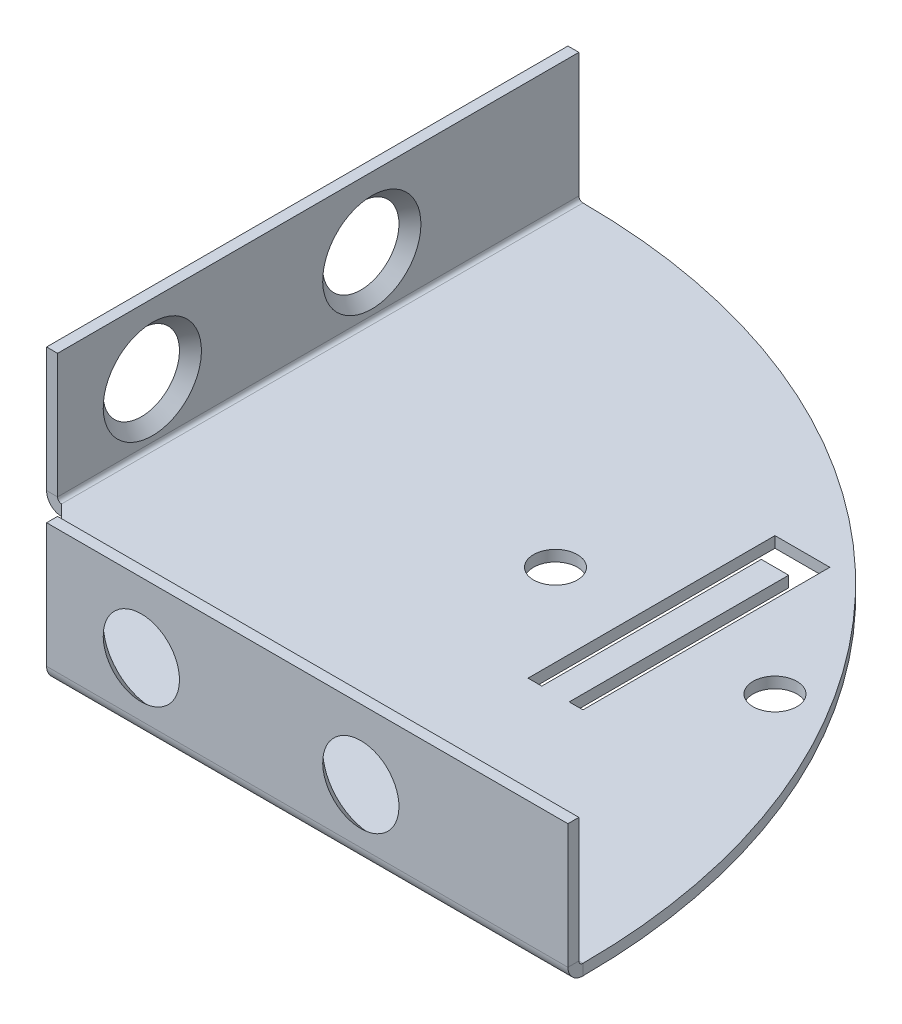
from build123d import *

# Parameters (mm, degrees)
BRIDA_BASE1_DEPTH               = 2
BRIDA_DE_ARISTA1_DEPTH          = 95
BRIDA_DE_ARISTA2_DEPTH          = 95
CROQUIS16_R                     = 4
CORTAR_EXTRUIR3_DEPTH           = 10
CROQUIS17_R                     = 8.95
CORTAR_EXTRUIR5_DEPTH           = 2
CORTAR_EXTRUIR5_DRAFT           = -45
CORTAR_EXTRUIR5_PROFILE_2_DEPTH = 2
CORTAR_EXTRUIR5_PROFILE_2_DRAFT = -45
CROQUIS18_R                     = 8.95
CORTAR_EXTRUIR6_DEPTH           = 2
CORTAR_EXTRUIR6_DRAFT           = -45
CORTAR_EXTRUIR6_PROFILE_2_DEPTH = 2
CORTAR_EXTRUIR6_PROFILE_2_DRAFT = -45


# Sheet-metal steps are written as plain solids
with BuildPart() as part:
    # Croquis1 → Brida base1 (new body)
    with BuildSketch(Plane(origin=(0, 0, 0), x_dir=(1, 0, 0), z_dir=(0, 1, 0))):
        with BuildLine():
            Line((0, 25), (25, 0))
            Line((25, 0), (120, 0))
            ThreePointArc((120, 0), (84.852813742, 84.852813742), (0, 120))
            Line((0, 120), (0, 25))
        make_face()
    extrude(amount=-BRIDA_BASE1_DEPTH)

    # Brida de arista1 section (across the edge) → Brida de arista1 (add)
    with BuildSketch(Plane(origin=(25, 0, 0.7366), x_dir=(0, 0, -1), z_dir=(1, 0, 0))):
        with BuildLine():
            Line((-2, 0.7366), (-2, 23.4))
            Line((-2, 23.4), (0, 23.4))
            Line((0, 23.4), (0, 0.7366))
            ThreePointArc((0, 0.7366), (0.215745145, 0.215745145), (0.7366, 0))
            Line((0.7366, 0), (0.7366, -2))
            ThreePointArc((0.7366, -2), (-1.198468417, -1.198468417), (-2, 0.7366))
        make_face()
    extrude(amount=BRIDA_DE_ARISTA1_DEPTH)

    # Brida de arista2 section (across the edge) → Brida de arista2 (add)
    with BuildSketch(Plane(origin=(-0.7366, 0, -120), x_dir=(1, 0, 0), z_dir=(0, 0, 1))):
        with BuildLine():
            Line((-2, 0.7366), (-2, 23.4))
            Line((-2, 23.4), (0, 23.4))
            Line((0, 23.4), (0, 0.7366))
            ThreePointArc((0, 0.7366), (0.215745145, 0.215745145), (0.7366, 0))
            Line((0.7366, 0), (0.7366, -2))
            ThreePointArc((0.7366, -2), (-1.198468417, -1.198468417), (-2, 0.7366))
        make_face()
    extrude(amount=BRIDA_DE_ARISTA2_DEPTH)

    # Croquis16 → Cortar-Extruir3 (cut)
    with BuildSketch(Plane(origin=(0, 0, 0), x_dir=(1, 0, 0), z_dir=(0, 1, 0))):
        with Locations(Location((55, 60, 0), (0, 0, 270))):
            Circle(CROQUIS16_R)
        with Locations(Location((95, 60, 0), (0, 0, 270))):
            Circle(CROQUIS16_R)
        Polygon((70, 40), (72.5, 40), (72.5, 80), (77.5, 80), (77.5, 40), (80, 40), (80, 85), (70, 85), align=None)
    extrude(amount=-CORTAR_EXTRUIR3_DEPTH, mode=Mode.SUBTRACT)


with BuildPart() as cortar_extruir5_tool:
    # Croquis17 → Cortar-Extruir5 (with draft: the straight prism first)
    with BuildSketch(Plane(origin=(0, 0, 0.7366), x_dir=(-1, 0, 0), z_dir=(0, 0, -1))):
        with Locations((-42.2634, 10.7)):
            Circle(CROQUIS17_R)
    extrude(amount=-CORTAR_EXTRUIR5_DEPTH)
    # Cortar-Extruir5: the draft: its side faces are tilted about the plane it starts from
    cortar_extruir5_sides = [cortar_extruir5_tool.faces().sort_by_distance(p)[0] for p in [
        (51.2134, 10.7, 1.7366),
    ]]
    draft(cortar_extruir5_sides, Plane(origin=(0, 0, 0.7366), x_dir=(-1, 0, 0), z_dir=(0, 0, -1)), CORTAR_EXTRUIR5_DRAFT)


with BuildPart() as part_1:
    add(part.part)

    # Cortar-Extruir5: cut by cortar_extruir5_tool
    add(cortar_extruir5_tool.part, mode=Mode.SUBTRACT)


with BuildPart() as cortar_extruir5_profile_2_tool:
    # Croquis17 → Cortar-Extruir5 profile 2 (with draft: the straight prism first)
    with BuildSketch(Plane(origin=(0, 0, 0.7366), x_dir=(-1, 0, 0), z_dir=(0, 0, -1))):
        with Locations((-82.2634, 10.7)):
            Circle(CROQUIS17_R)
    extrude(amount=-CORTAR_EXTRUIR5_PROFILE_2_DEPTH)
    # Cortar-Extruir5 profile 2: the draft: its side faces are tilted about the plane it starts from
    cortar_extruir5_profile_2_sides = [cortar_extruir5_profile_2_tool.faces().sort_by_distance(p)[0] for p in [
        (91.2134, 10.7, 1.7366),
    ]]
    draft(cortar_extruir5_profile_2_sides, Plane(origin=(0, 0, 0.7366), x_dir=(-1, 0, 0), z_dir=(0, 0, -1)), CORTAR_EXTRUIR5_PROFILE_2_DRAFT)


with BuildPart() as part_2:
    add(part_1.part)

    # Cortar-Extruir5 profile 2: cut by cortar_extruir5_profile_2_tool
    add(cortar_extruir5_profile_2_tool.part, mode=Mode.SUBTRACT)


with BuildPart() as cortar_extruir6_tool:
    # Croquis18 → Cortar-Extruir6 (with draft: the straight prism first)
    with BuildSketch(Plane(origin=(-0.7366, 0, 0), x_dir=(0, 0, -1), z_dir=(1, 0, 0))):
        with Locations((42.2634, 10.7)):
            Circle(CROQUIS18_R)
    extrude(amount=-CORTAR_EXTRUIR6_DEPTH)
    # Cortar-Extruir6: the draft: its side faces are tilted about the plane it starts from
    cortar_extruir6_sides = [cortar_extruir6_tool.faces().sort_by_distance(p)[0] for p in [
        (-1.7366, 10.7, -33.3134),
    ]]
    draft(cortar_extruir6_sides, Plane(origin=(-0.7366, 0, 0), x_dir=(0, 0, -1), z_dir=(1, 0, 0)), CORTAR_EXTRUIR6_DRAFT)


with BuildPart() as part_3:
    add(part_2.part)

    # Cortar-Extruir6: cut by cortar_extruir6_tool
    add(cortar_extruir6_tool.part, mode=Mode.SUBTRACT)


with BuildPart() as cortar_extruir6_profile_2_tool:
    # Croquis18 → Cortar-Extruir6 profile 2 (with draft: the straight prism first)
    with BuildSketch(Plane(origin=(-0.7366, 0, 0), x_dir=(0, 0, -1), z_dir=(1, 0, 0))):
        with Locations((82.2634, 10.7)):
            Circle(CROQUIS18_R)
    extrude(amount=-CORTAR_EXTRUIR6_PROFILE_2_DEPTH)
    # Cortar-Extruir6 profile 2: the draft: its side faces are tilted about the plane it starts from
    cortar_extruir6_profile_2_sides = [cortar_extruir6_profile_2_tool.faces().sort_by_distance(p)[0] for p in [
        (-1.7366, 10.7, -73.3134),
    ]]
    draft(cortar_extruir6_profile_2_sides, Plane(origin=(-0.7366, 0, 0), x_dir=(0, 0, -1), z_dir=(1, 0, 0)), CORTAR_EXTRUIR6_PROFILE_2_DRAFT)


with BuildPart() as part_4:
    add(part_3.part)

    # Cortar-Extruir6 profile 2: cut by cortar_extruir6_profile_2_tool
    add(cortar_extruir6_profile_2_tool.part, mode=Mode.SUBTRACT)


solid = part_4.part
